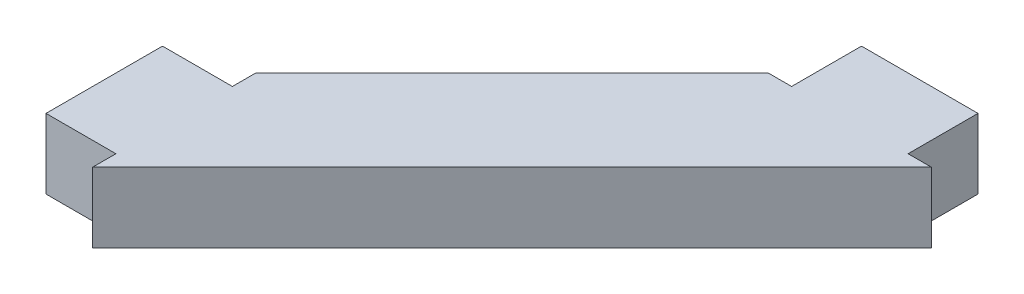
from build123d import *

# Parameters (mm, degrees)
EXTRUDE_1_DEPTH = 6


# Read off the part's stored shape, not the designer's step: 填料-伸長1
with BuildPart() as part:
    # 填料-伸長1 outline → 填料-伸長1 (new body)
    with BuildSketch(Plane(origin=(0, 0, 0), x_dir=(1, 0, 0), z_dir=(0, 1, 0))):
        Polygon((-81.673498196, -37), (-75.673498196, -37), (-75.673498196, -39), (-39.673498196, -3), (-41.673498196, -3), (-41.673498196, 3), (-51.673498196, 3), (-51.673498196, -3), (-53.673498196, -3), (-75.673498196, -25), (-75.673498196, -27), (-81.673498196, -27), align=None)
    extrude(amount=EXTRUDE_1_DEPTH)


solid = part.part
